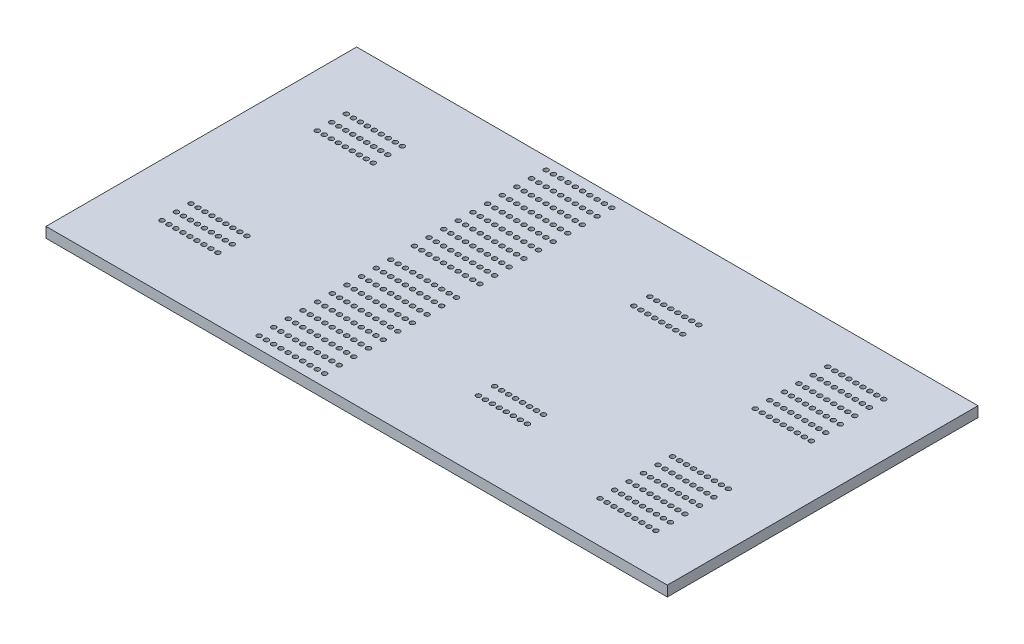
from build123d import *

# Parameters (mm, degrees)
ESQUISSE2_W                     = 120
ESQUISSE2_H                     = 30
BOSS_EXTRU_1_DEPTH              = 2
ENL_V_MAT_EXTRU_3_REACH         = 63.879
ESQUISSE8_R                     = 0.45
R_P_TITION_LIN_AIRE4_COUNT      = 9
R_P_TITION_LIN_AIRE4_PITCH      = 1.35
R_P_TITION_LIN_AIRE4_COUNT_DIR2 = 3
R_P_TITION_LIN_AIRE4_PITCH_DIR2 = 2.8
ENL_V_MAT_EXTRU_4_REACH         = 63.879
ESQUISSE10_R                    = 0.45
R_P_TITION_LIN_AIRE5_COUNT      = 10
R_P_TITION_LIN_AIRE5_PITCH      = 1.406
R_P_TITION_LIN_AIRE5_COUNT_DIR2 = 10
R_P_TITION_LIN_AIRE5_PITCH_DIR2 = 2.827777778
ENL_V_MAT_EXTRU_5_REACH         = 63.879
ESQUISSE12_R                    = 0.45
R_P_TITION_LIN_AIRE6_COUNT      = 8
R_P_TITION_LIN_AIRE6_PITCH      = 1.35
R_P_TITION_LIN_AIRE6_COUNT_DIR2 = 2
R_P_TITION_LIN_AIRE6_PITCH_DIR2 = 3.111
ENL_V_MAT_EXTRU_6_REACH         = 63.879
ESQUISSE14_R                    = 0.45
R_P_TITION_LIN_AIRE7_COUNT      = 9
R_P_TITION_LIN_AIRE7_PITCH      = 1.35
R_P_TITION_LIN_AIRE7_COUNT_DIR2 = 6
R_P_TITION_LIN_AIRE7_PITCH_DIR2 = 2.8


with BuildPart() as part:
    # Esquisse2 → Boss.-Extru.1 (new body)
    with BuildSketch(Plane(origin=(0, 0, 0), x_dir=(1, 0, 0), z_dir=(0, 1, 0))):
        Rectangle(ESQUISSE2_W, ESQUISSE2_H)
    extrude(amount=BOSS_EXTRU_1_DEPTH)

    # Esquisse8 → Enlèv. mat.-Extru.3 (cut, up to next)
    with BuildSketch(Plane(origin=(0, 2, 0), x_dir=(1, 0, 0), z_dir=(0, 1, 0)), mode=Mode.PRIVATE) as enl_v_mat_extru_3_sk1:
        with Locations((-49.8, 2.8)):
            Circle(ESQUISSE8_R)
    enl_v_mat_extru_3_tool1 = extrude(enl_v_mat_extru_3_sk1.sketch, amount=-ENL_V_MAT_EXTRU_3_REACH, mode=Mode.PRIVATE) & part.part
    enl_v_mat_extru_3 = enl_v_mat_extru_3_tool1.solids().sort_by_distance((-49.8, 2, -2.8))[0]
    add(enl_v_mat_extru_3, mode=Mode.SUBTRACT)

    # Répétition linéaire4: Enl_v. mat.-Extru.3 9 × 3
    with Locations(*[(i * R_P_TITION_LIN_AIRE4_PITCH, 0, j * R_P_TITION_LIN_AIRE4_PITCH_DIR2) for i in range(R_P_TITION_LIN_AIRE4_COUNT) for j in range(R_P_TITION_LIN_AIRE4_COUNT_DIR2) if (i, j) != (0, 0)]):
        add(enl_v_mat_extru_3, mode=Mode.SUBTRACT)

    # Esquisse10 → Enlèv. mat.-Extru.4 (cut, up to next)
    with BuildSketch(Plane(origin=(0, 2, 0), x_dir=(1, 0, 0), z_dir=(0, 1, 0)), mode=Mode.PRIVATE) as enl_v_mat_extru_4_sk1:
        with Locations((-21.127, 12.725)):
            Circle(ESQUISSE10_R)
    enl_v_mat_extru_4_tool1 = extrude(enl_v_mat_extru_4_sk1.sketch, amount=-ENL_V_MAT_EXTRU_4_REACH, mode=Mode.PRIVATE) & part.part
    enl_v_mat_extru_4 = enl_v_mat_extru_4_tool1.solids().sort_by_distance((-21.127, 2, -12.725))[0]
    add(enl_v_mat_extru_4, mode=Mode.SUBTRACT)

    # Répétition linéaire5: Enl_v. mat.-Extru.4 10 × 10
    with Locations(*[(i * R_P_TITION_LIN_AIRE5_PITCH, 0, j * R_P_TITION_LIN_AIRE5_PITCH_DIR2) for i in range(R_P_TITION_LIN_AIRE5_COUNT) for j in range(R_P_TITION_LIN_AIRE5_COUNT_DIR2) if (i, j) != (0, 0)]):
        add(enl_v_mat_extru_4, mode=Mode.SUBTRACT)

    # Esquisse12 → Enlèv. mat.-Extru.5 (cut, up to next)
    with BuildSketch(Plane(origin=(0, 2, 0), x_dir=(1, 0, 0), z_dir=(0, 1, 0)), mode=Mode.PRIVATE) as enl_v_mat_extru_5_sk1:
        with Locations((10.075, 1.5555)):
            Circle(ESQUISSE12_R)
    enl_v_mat_extru_5_tool1 = extrude(enl_v_mat_extru_5_sk1.sketch, amount=-ENL_V_MAT_EXTRU_5_REACH, mode=Mode.PRIVATE) & part.part
    enl_v_mat_extru_5 = enl_v_mat_extru_5_tool1.solids().sort_by_distance((10.075, 2, -1.5555))[0]
    add(enl_v_mat_extru_5, mode=Mode.SUBTRACT)

    # Répétition linéaire6: Enl_v. mat.-Extru.5 8 × 2
    with Locations(*[(i * R_P_TITION_LIN_AIRE6_PITCH, 0, j * R_P_TITION_LIN_AIRE6_PITCH_DIR2) for i in range(R_P_TITION_LIN_AIRE6_COUNT) for j in range(R_P_TITION_LIN_AIRE6_COUNT_DIR2) if (i, j) != (0, 0)]):
        add(enl_v_mat_extru_5, mode=Mode.SUBTRACT)

    # Esquisse14 → Enlèv. mat.-Extru.6 (cut, up to next)
    with BuildSketch(Plane(origin=(0, 2, 0), x_dir=(1, 0, 0), z_dir=(0, 1, 0)), mode=Mode.PRIVATE) as enl_v_mat_extru_6_sk1:
        with Locations((39, 7)):
            Circle(ESQUISSE14_R)
    enl_v_mat_extru_6_tool1 = extrude(enl_v_mat_extru_6_sk1.sketch, amount=-ENL_V_MAT_EXTRU_6_REACH, mode=Mode.PRIVATE) & part.part
    enl_v_mat_extru_6 = enl_v_mat_extru_6_tool1.solids().sort_by_distance((39, 2, -7))[0]
    add(enl_v_mat_extru_6, mode=Mode.SUBTRACT)

    # Répétition linéaire7: Enl_v. mat.-Extru.6 9 × 6
    with Locations(*[(i * R_P_TITION_LIN_AIRE7_PITCH, 0, j * R_P_TITION_LIN_AIRE7_PITCH_DIR2) for i in range(R_P_TITION_LIN_AIRE7_COUNT) for j in range(R_P_TITION_LIN_AIRE7_COUNT_DIR2) if (i, j) != (0, 0)]):
        add(enl_v_mat_extru_6, mode=Mode.SUBTRACT)

    # Symétrie1: part across plane


with BuildPart() as part_1:
    add(part.part)
    add(part.part.mirror(Plane(origin=(-60, 2, 15), x_dir=(1, 0, 0), z_dir=(0, 0, -1))))


solid = part_1.part
